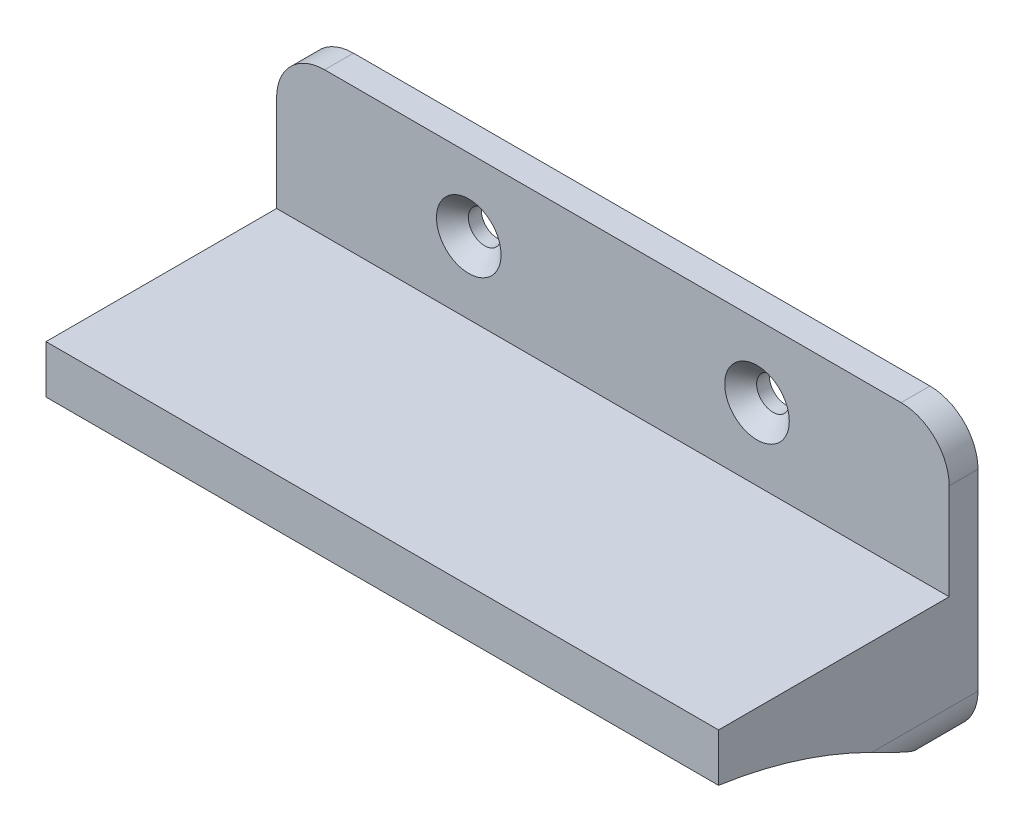
from build123d import *

# Parameters (mm, degrees)
CROQUIS1_W                                   = 70
CROQUIS1_H                                   = 30
SALIENTE_EXTRUIR1_DEPTH                      = 3
SALIENTE_EXTRUIR2_DEPTH                      = 24
CORTAR_EXTRUIR1_DEPTH                        = 70.000004
CROQUIS5_R                                   = 1.5
CORTAR_EXTRUIR2_DEPTH                        = 3
REFRENTADO_PARA_TORNILLO_TAP_N_CON_C_2_COUNT = 2
REFRENTADO_PARA_TORNILLO_TAP_N_CON_C_2_PITCH = 30
REDONDEO1_R                                  = 5


with BuildPart() as part:
    # Croquis1 → Saliente-Extruir1 (new body)
    with BuildSketch(Plane.XY):
        with Locations((5.076335878, 0.496183206)):
            Rectangle(CROQUIS1_W, CROQUIS1_H)
    extrude(amount=SALIENTE_EXTRUIR1_DEPTH)

    # Croquis3 → Saliente-Extruir2 (add)
    with BuildSketch(Plane.XY.offset(3)):
        Polygon((-29.923664122, 0.496183206), (40.076335878, 0.496183206), (40.076335878, -4.503816794), (40.076335878, -14.503816794), (36.076335878, -14.503816794), (36.076335878, -4.503816794), (18.076335878, -4.503816794), (18.076335878, -14.503816794), (14.076335878, -14.503816794), (14.076335878, -4.503816794), (-3.923664122, -4.503816794), (-3.923664122, -14.503816794), (-7.923664122, -14.503816794), (-7.923664122, -4.503816794), (-25.923664122, -4.503816794), (-25.923664122, -14.503816794), (-29.923664122, -14.503816794), (-29.923664122, -4.503816794), align=None)
    extrude(amount=SALIENTE_EXTRUIR2_DEPTH)

    # Croquis4 → Cortar-Extruir1 (cut)
    with BuildSketch(Plane.ZY.offset(29.923664122)):
        with BuildLine():
            Line((27, -14.503816794), (27, -4.503816794))
            ThreePointArc((27, -4.503816794), (14.366976751, -7.984560996), (3, -14.503816794))
            Line((3, -14.503816794), (27, -14.503816794))
        make_face()
    extrude(amount=-CORTAR_EXTRUIR1_DEPTH, mode=Mode.SUBTRACT)

    # Croquis5 → Cortar-Extruir2 (cut)
    with BuildSketch(Plane.XY.offset(3)):
        with Locations((-9.923664122, 7.996183206)):
            Circle(CROQUIS5_R)
        with Locations(Location((20.076335878, 7.996183206, 0), (0, 0, 180))):
            Circle(CROQUIS5_R)
    extrude(amount=-CORTAR_EXTRUIR2_DEPTH, mode=Mode.SUBTRACT)

    # Croquis7 → Refrentado para tornillo tapón con cabeza plana de clavija de M31 (revolve, cut)
    with BuildSketch(Plane(origin=(-9.923664122, 7.996183206, 3), x_dir=(0, -1, 0), z_dir=(1, 0, 0))):
        Polygon((0, 0), (0, 3), (1.7, 3), (1.7, 1.66), (3.36, 0), align=None)
    refrentado_para_tornillo_tap_n_con_cabez = revolve(axis=Axis((-9.923664122, 7.996183206, 9.35), (0, 0, -1)), mode=Mode.SUBTRACT)

    # Refrentado para tornillo tap_n con c 2: Refrentado para tornillo tapón con cabeza plana de clavija de M31 ×2
    with Locations(*[(i * REFRENTADO_PARA_TORNILLO_TAP_N_CON_C_2_PITCH, 0, 0) for i in range(1, REFRENTADO_PARA_TORNILLO_TAP_N_CON_C_2_COUNT)]):
        add(refrentado_para_tornillo_tap_n_con_cabez, mode=Mode.SUBTRACT)

    # Redondeo1
    # the kernel refuses this fillet: 5 mm, written as the material it takes off along each edge
    with BuildSketch(Plane(origin=(40.076335878, -14.503816794, 15.5), x_dir=(0, 1, 0), z_dir=(0, 0, -1)), Plane(origin=(-29.923664122, -14.503816794, -12.5), x_dir=(0, 1, 0), z_dir=(0, 0, 1)), Plane(origin=(-29.923664122, 15.496183206, -12.5), x_dir=(1, 0, 0), z_dir=(0, 0, 1))) as redondeo1_piece_1:
        with BuildLine():
            CenterArc((REDONDEO1_R, -REDONDEO1_R), REDONDEO1_R, 90, 90)
            Line((0, -REDONDEO1_R), (0, 0))
            Line((0, 0), (REDONDEO1_R, 0))
        make_face()
    extrude(amount=28, mode=Mode.SUBTRACT)
    with BuildSketch(Plane(origin=(40.076335878, 15.496183206, -12.5), x_dir=(-1, 0, 0), z_dir=(0, 0, 1))) as redondeo1_piece_2:
        with BuildLine():
            CenterArc((REDONDEO1_R, REDONDEO1_R), REDONDEO1_R, 180, 90)
            Line((0, REDONDEO1_R), (0, 0))
            Line((0, 0), (REDONDEO1_R, 0))
        make_face()
    extrude(amount=28, mode=Mode.SUBTRACT)


solid = part.part
